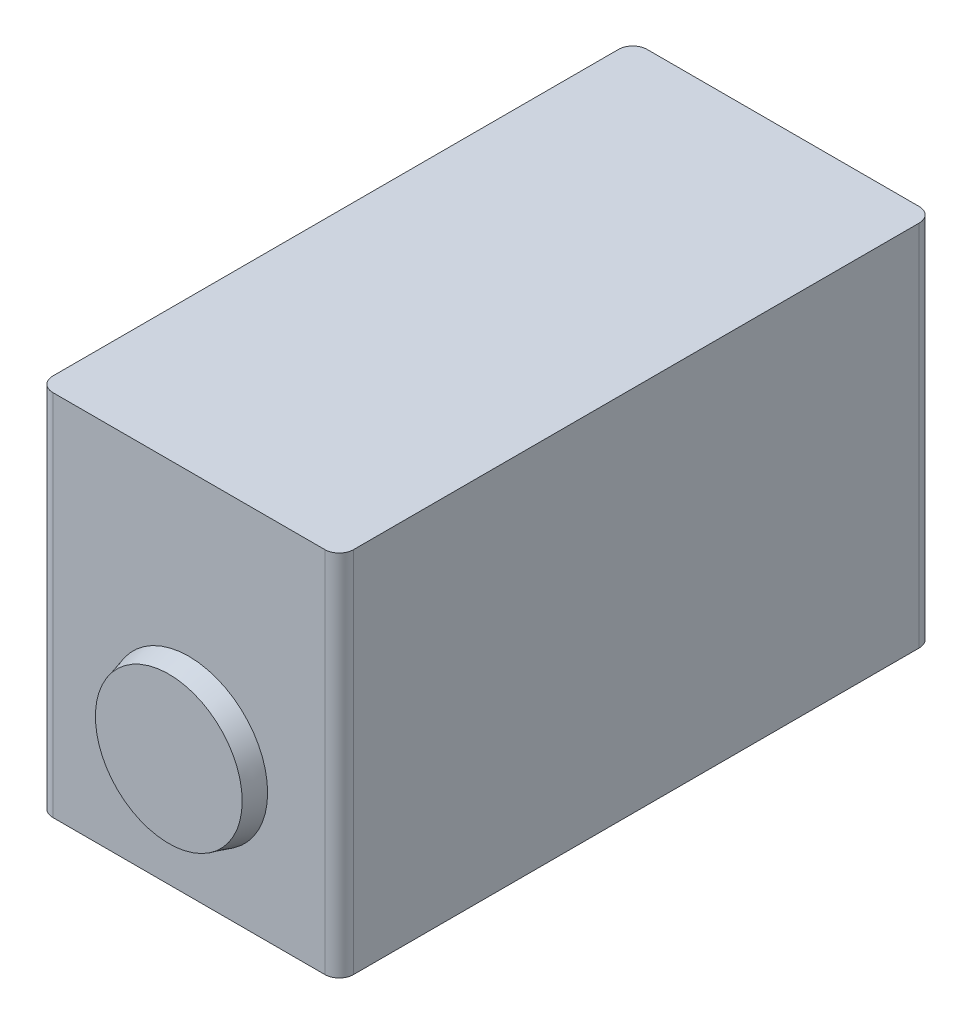
from build123d import *

# Parameters (mm, degrees)
SKETCH1_W           = 21
SKETCH1_H           = 41.5
BOSS_EXTRUDE1_DEPTH = 25.7
FILLET1_R           = 1
SKETCH2_R           = 5.5
BOSS_EXTRUDE2_DEPTH = 1.4
BOSS_EXTRUDE2_TAPER = 15


with BuildPart() as part:
    # Sketch1 → Boss-Extrude1 (new body)
    with BuildSketch(Plane(origin=(0, 0, 0), x_dir=(1, 0, 0), z_dir=(0, 1, 0))):
        Rectangle(SKETCH1_W, SKETCH1_H)
    extrude(amount=BOSS_EXTRUDE1_DEPTH)

    # Fillet1
    fillet1_edges = [part.edges().sort_by_distance(p)[0] for p in [
        (-10.5, 12.85, -20.75),
        (10.5, 12.85, -20.75),
        (-10.5, 12.85, 20.75),
        (10.5, 12.85, 20.75),
    ]]
    fillet(fillet1_edges, radius=FILLET1_R)

    # Sketch2 → Boss-Extrude2 (add)
    with BuildSketch(Plane.XY.offset(20.75)):
        with Locations((0, 9)):
            Circle(SKETCH2_R)
    extrude(amount=BOSS_EXTRUDE2_DEPTH, taper=BOSS_EXTRUDE2_TAPER)


solid = part.part
